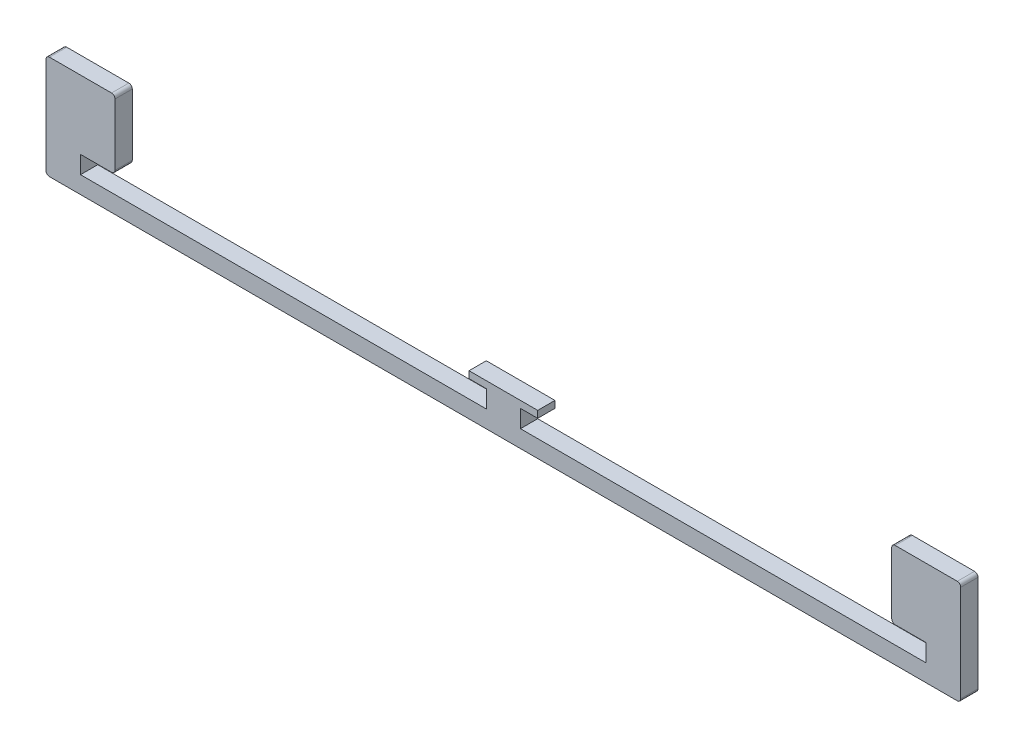
from build123d import *

# Parameters (mm, degrees)
BOSS_EXTRUDE1_DEPTH = 5
FILLET1_R           = 1


with BuildPart() as part:
    # Sketch1 → Boss-Extrude1 (new body)
    with BuildSketch(Plane.XY):
        Polygon((0, 0), (132.55, 0), (132.55, 12.1), (122.6, 12.1), (122.6, 10.1), (127.6, 10.1), (127.6, 5), (10, 5), (10, 10.1), (20, 10.1), (20, 30), (0, 30), align=None)
    extrude(amount=BOSS_EXTRUDE1_DEPTH)

    # Mirror1: part across plane


with BuildPart() as part_1:
    add(part.part)
    add(part.part.mirror(Plane(origin=(132.55, 12.1, 5), x_dir=(0, 0, 1), z_dir=(-1, 0, 0))))

    # Fillet1
    fillet1_edges = [part_1.edges().sort_by_distance(p)[0] for p in [
        (265.1, 0, 2.5),
        (265.1, 30, 2.5),
        (245.1, 30, 2.5),
        (245.1, 10.1, 2.5),
        (0, 0, 2.5),
        (0, 30, 2.5),
        (20, 30, 2.5),
        (20, 10.1, 2.5),
    ]]
    fillet(fillet1_edges, radius=FILLET1_R)


solid = part_1.part
